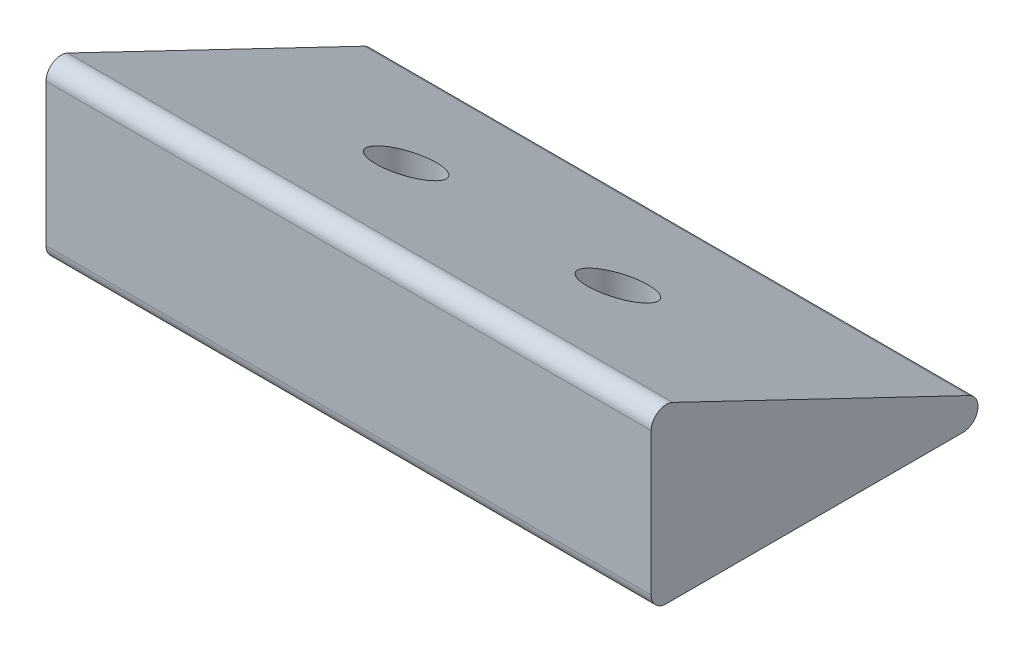
from build123d import *

# Parameters (mm, degrees)
BOSS_EXTRUDE2_DEPTH = 40
SKETCH5_R           = 2
CUT_EXTRUDE4_DEPTH  = 8
SKETCH6_R           = 1.5
CUT_EXTRUDE5_DEPTH  = 8


with BuildPart() as part:
    # Sketch4 → Boss-Extrude2 (new body)
    with BuildSketch(Plane(origin=(0, 0, 0), x_dir=(0, 0, -1), z_dir=(1, 0, 0))):
        with BuildLine():
            Line((0, 1), (0, 10.41076603))
            ThreePointArc((0, 10.41076603), (0.467426563, 11.257149828), (1.432731068, 11.312289088))
            Line((1.432731068, 11.312289088), (21.03849363, 1.901523057))
            ThreePointArc((21.03849363, 1.901523057), (21.580832575, 0.778102566), (20.605762563, 0))
            Line((20.605762563, 0), (1, 0))
            ThreePointArc((1, 0), (0.292893219, 0.292893219), (0, 1))
        make_face()
    extrude(amount=BOSS_EXTRUDE2_DEPTH)

    # Sketch5 → Cut-Extrude4 (cut)
    with BuildSketch(Plane(origin=(0, 10, 0), x_dir=(-1, 0, 0), z_dir=(0, -1, 0))):
        with Locations((-13, 10.802881281)):
            Circle(SKETCH5_R)
        with Locations((-27, 10.802881281)):
            Circle(SKETCH5_R)
    extrude(amount=CUT_EXTRUDE4_DEPTH, mode=Mode.SUBTRACT)

    # Sketch6 → Cut-Extrude5 (cut)
    with BuildSketch(Plane(origin=(0, 2, 0), x_dir=(1, 0, 0), z_dir=(0, 1, 0))):
        with Locations((13, 10.802881281)):
            Circle(SKETCH6_R)
        with Locations((27, 10.802881281)):
            Circle(SKETCH6_R)
    extrude(amount=-CUT_EXTRUDE5_DEPTH, mode=Mode.SUBTRACT)


solid = part.part
